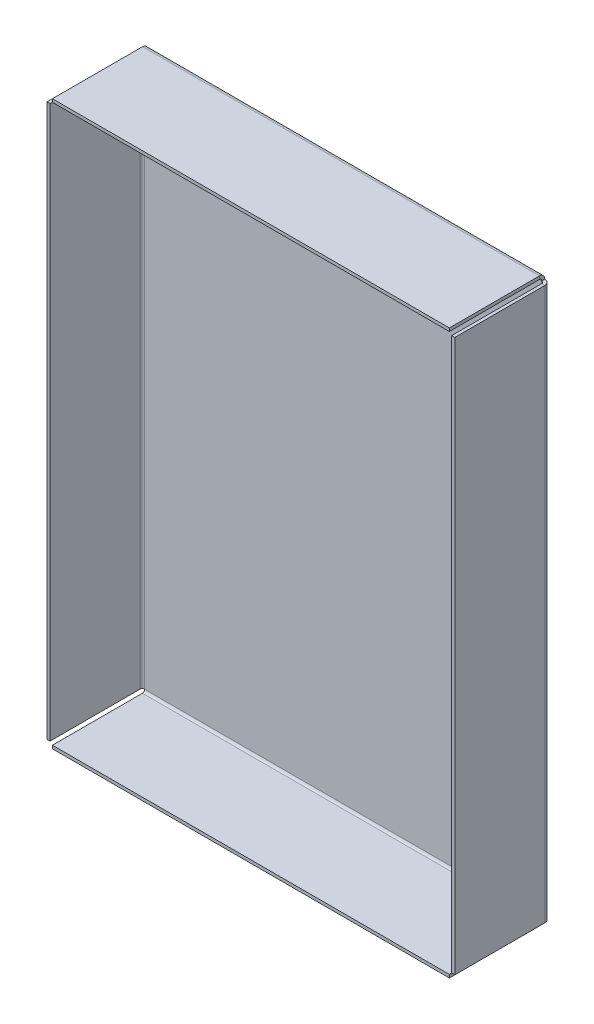
from build123d import *

# Parameters (mm, degrees)
BASE_FLANGE1_DEPTH         = 1
SKETCHED_START             = 31
SKETCHED_BEND1_DEPTH       = 178
SKETCHED_BEND1_2_DEPTH     = 128
SKETCHED_BEND1_3_DEPTH     = 178
SKETCHED_BEND1_4_OUTLINE_W = 128
SKETCHED_BEND1_4_OUTLINE_H = 1
SKETCHED_BEND1_4_DEPTH     = 29.234623369
SKETCHED_START_2           = 210.765376631
SKETCHED_BEND1_5_OUTLINE_W = 128
SKETCHED_BEND1_5_OUTLINE_H = 1
SKETCHED_BEND1_5_DEPTH     = 29.234623369
SKETCHED_BEND1_6_DEPTH     = 128
SKETCHED_BEND1_7_OUTLINE_W = 178
SKETCHED_BEND1_7_OUTLINE_H = 1
SKETCHED_BEND1_7_DEPTH     = 29.234623369
SKETCHED_START_3           = 160.765376631
SKETCHED_BEND1_8_OUTLINE_W = 178
SKETCHED_BEND1_8_OUTLINE_H = 1
SKETCHED_BEND1_8_DEPTH     = 29.234623369


# Read off the part's stored shape, not the designer's step: Sketched Bend1
# Sheet-metal steps are written as plain solids
with BuildPart() as part:
    # Sketch1 → Base-Flange1 (new body)
    with BuildSketch(Plane.XY):
        Polygon((0, 209), (31, 209), (31, 240), (159, 240), (159, 209), (190, 209), (190, 31), (159, 31), (159, 0), (31, 0), (31, 31), (0, 31), align=None)
    extrude(amount=-BASE_FLANGE1_DEPTH)

    # Sketched Bend1 outline → Sketched Bend1 (add)
    with BuildSketch(Plane(origin=(0, 0, 0), x_dir=(1, 0, 0), z_dir=(0, 1, 0)).offset(SKETCHED_START)):
        with BuildLine():
            Line((29.234623369, -0.7366), (29.234623369, -29.765376631))
            Line((29.234623369, -29.765376631), (30.234623369, -29.765376631))
            Line((30.234623369, -29.765376631), (30.234623369, -0.7366))
            ThreePointArc((30.234623369, -0.7366), (30.450368514, -0.215745145), (30.971223369, 0))
            Line((30.971223369, 0), (29.398582279, 0))
            ThreePointArc((29.398582279, 0), (29.276108612, -0.359286442), (29.234623369, -0.7366))
        make_face()
        with BuildLine():
            Line((160.601417721, 0), (159.028776631, 0))
            ThreePointArc((159.028776631, 0), (159.549631486, -0.215745145), (159.765376631, -0.7366))
            Line((159.765376631, -0.7366), (159.765376631, -29.765376631))
            Line((159.765376631, -29.765376631), (160.765376631, -29.765376631))
            Line((160.765376631, -29.765376631), (160.765376631, -0.7366))
            ThreePointArc((160.765376631, -0.7366), (160.723891388, -0.359286442), (160.601417721, 0))
        make_face()
    extrude(amount=SKETCHED_BEND1_DEPTH)

    # Sketched Bend1 2 outline → Sketched Bend1 2 (add)
    with BuildSketch(Plane.YZ.offset(SKETCHED_START)):
        with BuildLine():
            Line((209.028776631, 0), (210.601417721, 0))
            ThreePointArc((210.601417721, 0), (210.723891388, 0.359286442), (210.765376631, 0.7366))
            Line((210.765376631, 0.7366), (210.765376631, 29.765376631))
            Line((210.765376631, 29.765376631), (209.765376631, 29.765376631))
            Line((209.765376631, 29.765376631), (209.765376631, 0.7366))
            ThreePointArc((209.765376631, 0.7366), (209.549631486, 0.215745145), (209.028776631, 0))
        make_face()
        with BuildLine():
            ThreePointArc((29.234623369, 0.7366), (29.276108612, 0.359286442), (29.398582279, 0))
            Line((29.398582279, 0), (30.971223369, 0))
            ThreePointArc((30.971223369, 0), (30.450368514, 0.215745145), (30.234623369, 0.7366))
            Line((30.234623369, 0.7366), (30.234623369, 29.765376631))
            Line((30.234623369, 29.765376631), (29.234623369, 29.765376631))
            Line((29.234623369, 29.765376631), (29.234623369, 0.7366))
        make_face()
    extrude(amount=SKETCHED_BEND1_2_DEPTH)

    # Sketched Bend1 3 outline → Sketched Bend1 3 (cut)
    with BuildSketch(Plane(origin=(0, 0, 0), x_dir=(1, 0, 0), z_dir=(0, 1, 0)).offset(SKETCHED_START)):
        with BuildLine():
            Line((0, 0), (29.398582279, 0))
            ThreePointArc((29.398582279, 0), (30.039397205, 0.728828115), (30.971223369, 1))
            Line((30.971223369, 1), (0, 1))
            Line((0, 1), (0, 0))
        make_face()
        with BuildLine():
            Line((190, 1), (159.028776631, 1))
            ThreePointArc((159.028776631, 1), (159.960602795, 0.728828115), (160.601417721, 0))
            Line((160.601417721, 0), (190, 0))
            Line((190, 0), (190, 1))
        make_face()
    extrude(amount=SKETCHED_BEND1_3_DEPTH, mode=Mode.SUBTRACT)

    # Sketched Bend1 4 outline → Sketched Bend1 4 (cut)
    with BuildSketch(Plane(origin=(0, 0, 0), x_dir=(1, 0, 0), z_dir=(0, 1, 0))):
        with Locations((95, 0.5)):
            Rectangle(SKETCHED_BEND1_4_OUTLINE_W, SKETCHED_BEND1_4_OUTLINE_H)
    extrude(amount=SKETCHED_BEND1_4_DEPTH, mode=Mode.SUBTRACT)

    # Sketched Bend1 5 outline → Sketched Bend1 5 (cut)
    with BuildSketch(Plane(origin=(0, 0, 0), x_dir=(1, 0, 0), z_dir=(0, 1, 0)).offset(SKETCHED_START_2)):
        with Locations((95, 0.5)):
            Rectangle(SKETCHED_BEND1_5_OUTLINE_W, SKETCHED_BEND1_5_OUTLINE_H)
    extrude(amount=SKETCHED_BEND1_5_DEPTH, mode=Mode.SUBTRACT)

    # Sketched Bend1 6 outline → Sketched Bend1 6 (cut)
    with BuildSketch(Plane.YZ.offset(SKETCHED_START)):
        with BuildLine():
            ThreePointArc((210.601417721, 0), (209.960602795, -0.728828115), (209.028776631, -1))
            Line((209.028776631, -1), (240, -1))
            Line((240, -1), (240, 0))
            Line((240, 0), (210.601417721, 0))
        make_face()
        with BuildLine():
            Line((0, -1), (30.971223369, -1))
            ThreePointArc((30.971223369, -1), (30.039397205, -0.728828115), (29.398582279, 0))
            Line((29.398582279, 0), (0, 0))
            Line((0, 0), (0, -1))
        make_face()
    extrude(amount=SKETCHED_BEND1_6_DEPTH, mode=Mode.SUBTRACT)

    # Sketched Bend1 7 outline → Sketched Bend1 7 (cut)
    with BuildSketch(Plane.YZ):
        with Locations((120, -0.5)):
            Rectangle(SKETCHED_BEND1_7_OUTLINE_W, SKETCHED_BEND1_7_OUTLINE_H)
    extrude(amount=SKETCHED_BEND1_7_DEPTH, mode=Mode.SUBTRACT)

    # Sketched Bend1 8 outline → Sketched Bend1 8 (cut)
    with BuildSketch(Plane.YZ.offset(SKETCHED_START_3)):
        with Locations((120, -0.5)):
            Rectangle(SKETCHED_BEND1_8_OUTLINE_W, SKETCHED_BEND1_8_OUTLINE_H)
    extrude(amount=SKETCHED_BEND1_8_DEPTH, mode=Mode.SUBTRACT)


solid = part.part
